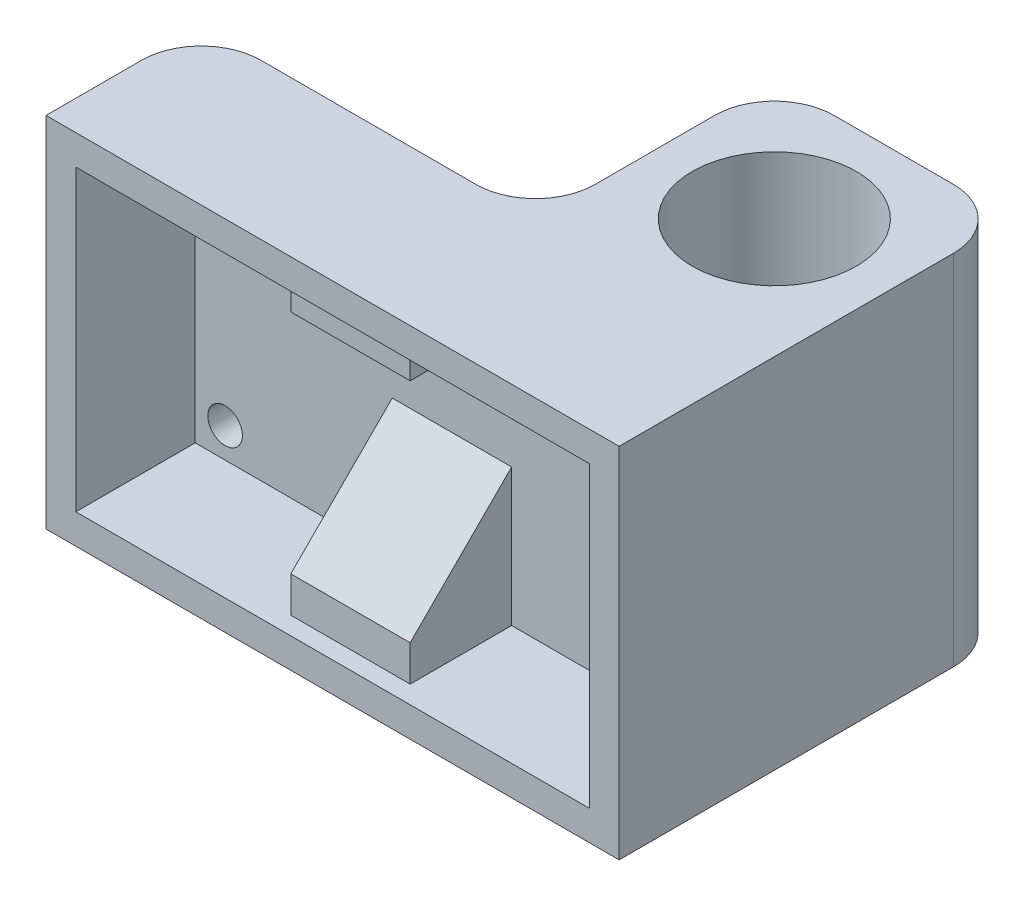
from build123d import *

# Parameters (mm, degrees)
SKETCH1_W           = 48
SKETCH1_H           = 30
BOSS_EXTRUDE1_DEPTH = 10
SKETCH2_W           = 10
SKETCH2_H           = 3
CUT_EXTRUDE1_DEPTH  = 1.5
SKETCH3_W           = 48
SKETCH3_H           = 30
SKETCH3_R           = 1.45
BOSS_EXTRUDE2_DEPTH = 3
SKETCH4_W           = 20
SKETCH4_H           = 30
SKETCH4_R           = 1.45
BOSS_EXTRUDE3_DEPTH = 20
SKETCH5_R           = 6.875
CUT_EXTRUDE2_DEPTH  = 35
FILLET1_R           = 5
CHAMFER1_SIZE       = 8.5


# Some blends are built 0.0001 mm under size
with BuildPart() as part:
    # Sketch1 → Boss-Extrude1 (new body)
    with BuildSketch(Plane.XY):
        with Locations((21, 12)):
            Rectangle(SKETCH1_W, SKETCH1_H)
        Polygon((-0.5, 24.5), (16, 24.5), (16, 21.5), (26, 21.5), (26, 24.5), (42.5, 24.5), (42.5, -0.5), (26, -0.5), (26, 2.5), (16, 2.5), (16, -0.5), (-0.5, -0.5), align=None, mode=Mode.SUBTRACT)
    extrude(amount=BOSS_EXTRUDE1_DEPTH)

    # Sketch2 → Cut-Extrude1 (cut)
    with BuildSketch(Plane.XY.offset(10)):
        with Locations((21, 1)):
            Rectangle(SKETCH2_W, SKETCH2_H)
        with Locations((21, 23)):
            Rectangle(SKETCH2_W, SKETCH2_H)
    extrude(amount=-CUT_EXTRUDE1_DEPTH, mode=Mode.SUBTRACT)

    # Sketch3 → Boss-Extrude2 (add)
    with BuildSketch(Plane(origin=(0, 0, 0), x_dir=(-1, 0, 0), z_dir=(0, 0, -1))):
        with Locations((-21, 12)):
            Rectangle(SKETCH3_W, SKETCH3_H)
        with Locations((-40, 22)):
            Circle(SKETCH3_R, mode=Mode.SUBTRACT)
        with Locations((-40, 2)):
            Circle(SKETCH3_R, mode=Mode.SUBTRACT)
        with Locations((-2, 22)):
            Circle(SKETCH3_R, mode=Mode.SUBTRACT)
        with Locations((-2, 2)):
            Circle(SKETCH3_R, mode=Mode.SUBTRACT)
    extrude(amount=BOSS_EXTRUDE2_DEPTH)

    # Sketch4 → Boss-Extrude3 (add)
    with BuildSketch(Plane(origin=(0, 0, -3), x_dir=(-1, 0, 0), z_dir=(0, 0, -1))):
        with Locations((-35, 12)):
            Rectangle(SKETCH4_W, SKETCH4_H)
        with Locations((-40, 22)):
            Circle(SKETCH4_R, mode=Mode.SUBTRACT)
        with Locations((-40, 2)):
            Circle(SKETCH4_R, mode=Mode.SUBTRACT)
    extrude(amount=BOSS_EXTRUDE3_DEPTH)

    # Sketch5 → Cut-Extrude2 (cut)
    with BuildSketch(Plane(origin=(0, 27, 0), x_dir=(1, 0, 0), z_dir=(0, 1, 0))):
        with Locations(Location((35, 13, 0), (0, 0, 270))):
            Circle(SKETCH5_R)
    extrude(amount=-CUT_EXTRUDE2_DEPTH, mode=Mode.SUBTRACT)

    # Fillet1
    # the kernel refuses this fillet: 5 mm, written as the material it adds along each edge
    with BuildSketch(Plane(origin=(25, 27, -3), x_dir=(-1, 0, 0), z_dir=(0, -1, 0))) as fillet1_piece_1:
        with BuildLine():
            CenterArc((FILLET1_R, FILLET1_R), FILLET1_R, 180, 90)
            Line((0, FILLET1_R), (0, 0))
            Line((0, 0), (FILLET1_R, 0))
        make_face()
    extrude(amount=30)
    # the kernel refuses this fillet: 5 mm, written as the material it takes off along each edge
    with BuildSketch(Plane(origin=(45, -15.5, -23), x_dir=(0, 0, 1), z_dir=(0, 1, 0)), Plane(origin=(-3, 39.5, -3), x_dir=(0, 0, 1), z_dir=(0, -1, 0))) as fillet1_2_piece_1:
        with BuildLine():
            CenterArc((FILLET1_R, -FILLET1_R), FILLET1_R, 90, 90)
            Line((0, -FILLET1_R), (0, 0))
            Line((0, 0), (FILLET1_R, 0))
        make_face()
    extrude(amount=55, mode=Mode.SUBTRACT)
    with BuildSketch(Plane(origin=(25, 39.5, -23), x_dir=(1, 0, 0), z_dir=(0, -1, 0))) as fillet1_2_piece_2:
        with BuildLine():
            CenterArc((FILLET1_R, FILLET1_R), FILLET1_R, 180, 90)
            Line((0, FILLET1_R), (0, 0))
            Line((0, 0), (FILLET1_R, 0))
        make_face()
    extrude(amount=55, mode=Mode.SUBTRACT)

    # Chamfer1
    chamfer1_edges = [part.edges().sort_by_distance(p)[0] for p in [
        (21, 2.5, 0),
    ]]
    chamfer(chamfer1_edges, length=CHAMFER1_SIZE - 0.0001)  # a hair under: the kernel refuses the full size


solid = part.part
